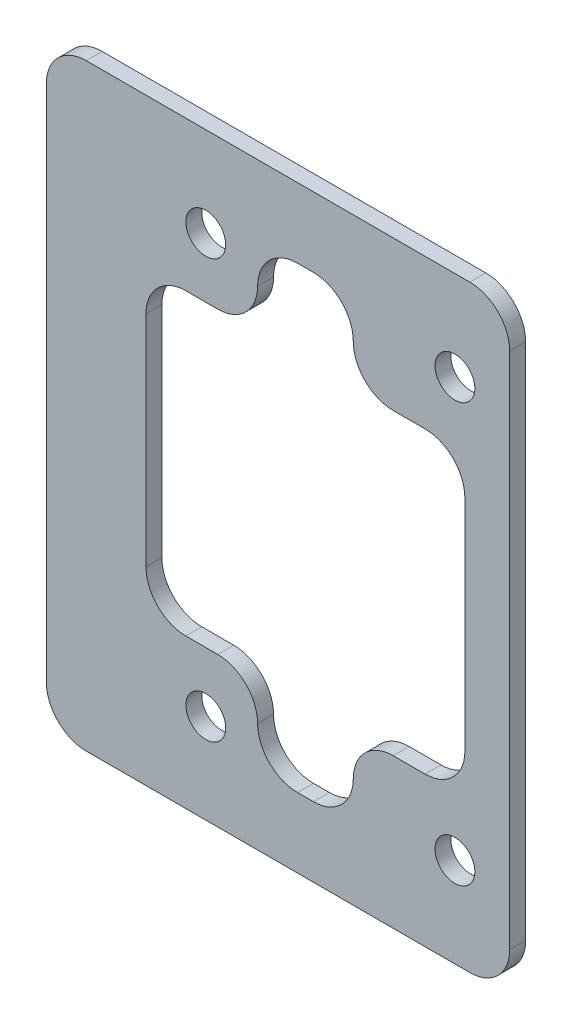
from build123d import *

# Parameters (mm, degrees)
SKETCH1_W       = 23.25
SKETCH1_H       = 30
SKETCH1_R       = 1
BODY_DEPTH      = 0.8
CORNER_FILLET_R = 2
CUTOUT_DEPTH    = 49.678263528
CUTOUT_FILLET_R = 2


with BuildPart() as part:
    # Sketch1 → body (new body)
    with BuildSketch(Plane.XY):
        with Locations((16.812358178, 24.5)):
            Rectangle(SKETCH1_W, SKETCH1_H)
        with Locations((25.687358178, 14)):
            Circle(SKETCH1_R, mode=Mode.SUBTRACT)
        with Locations(Location((25.687358178, 35, 0), (0, 0, 180))):
            Circle(SKETCH1_R, mode=Mode.SUBTRACT)
        with Locations(Location((13.187358178, 14, 0), (0, 0, 180))):
            Circle(SKETCH1_R, mode=Mode.SUBTRACT)
        with Locations((13.187358178, 35)):
            Circle(SKETCH1_R, mode=Mode.SUBTRACT)
    extrude(amount=BODY_DEPTH)

    # corner fillet
    corner_fillet_edges = [part.edges().sort_by_distance(p)[0] for p in [
        (5.187358178, 39.5, 0.4),
        (28.437358178, 39.5, 0.4),
        (28.437358178, 9.5, 0.4),
        (5.187358178, 9.5, 0.4),
    ]]
    fillet(corner_fillet_edges, radius=CORNER_FILLET_R)

    # Sketch2 → cutout (cut, through all)
    with BuildSketch(Plane(origin=(0, 0, 0), x_dir=(-1, 0, 0), z_dir=(0, 0, -1))):
        Polygon((-26.187358178, 17), (-26.187358178, 32), (-20.587358178, 32), (-20.587358178, 36), (-15.787358178, 36), (-15.787358178, 32), (-10.187358178, 32), (-10.187358178, 17), (-15.787358178, 17), (-15.787358178, 13), (-20.587358178, 13), (-20.587358178, 17), align=None)
    extrude(amount=-CUTOUT_DEPTH, mode=Mode.SUBTRACT)

    # cutout fillet
    cutout_fillet_edges = [part.edges().sort_by_distance(p)[0] for p in [
        (26.187358178, 32, 0.4),
        (20.587358178, 32, 0.4),
        (20.587358178, 36, 0.4),
        (15.787358178, 36, 0.4),
        (15.787358178, 32, 0.4),
        (10.187358178, 32, 0.4),
        (10.187358178, 17, 0.4),
        (15.787358178, 17, 0.4),
        (15.787358178, 13, 0.4),
        (20.587358178, 13, 0.4),
        (20.587358178, 17, 0.4),
        (26.187358178, 17, 0.4),
    ]]
    fillet(cutout_fillet_edges, radius=CUTOUT_FILLET_R - 0.0001)  # a hair under: the kernel refuses the full size


solid = part.part
